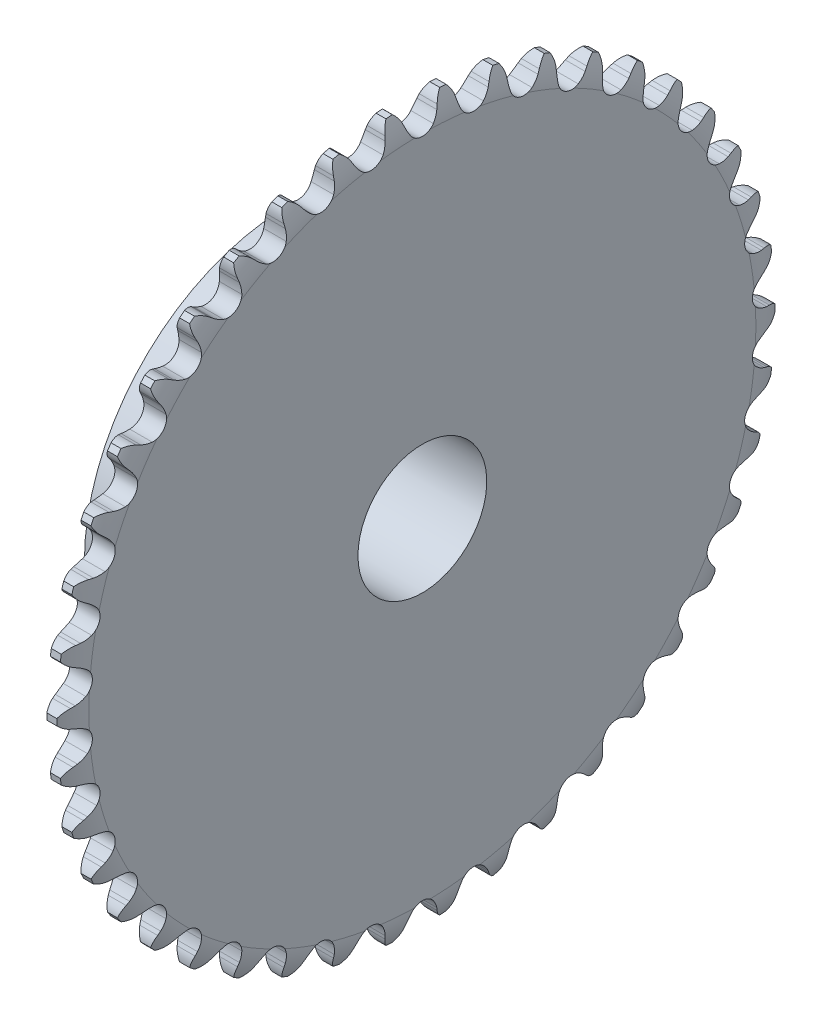
from build123d import *

# Parameters (mm, degrees)
TOOTHCUT_DEPTH   = 63.673265406
TEETHCUTS_COUNT  = 42
TEETHCUTS_ANGLE  = 351.428571429
HUBNEAONESKE_R   = 25.4
HUBNEARONE_DEPTH = 13.4560056
BORSKE_R         = 7.9375
BORE_DEPTH       = 16.2563556


with BuildPart() as part:
    # BasProSke → Base-Revolve (revolve)
    with BuildSketch(Plane(origin=(0, 0, 0), x_dir=(1, 0, 0), z_dir=(0, 1, 0))):
        with BuildLine():
            Line((0, 0), (0, 41.097430679))
            ThreePointArc((0, 41.097430679), (0.199787117, 42.733021074), (0.7874, 44.272430679))
            Line((0.7874, 44.272430679), (2.01295, 44.272430679))
            ThreePointArc((2.01295, 44.272430679), (2.600562883, 42.733021074), (2.80035, 41.097430679))
            Line((2.80035, 41.097430679), (2.80035, 0))
            Line((2.80035, 0), (0, 0))
        make_face()
    revolve(axis=Axis((-10, 0, 0), (1, 0, 0)))

    # TooCutSke → ToothCut (cut, through all)
    with BuildSketch(Plane(origin=(0, 0, 0), x_dir=(0, 0, -1), z_dir=(1, 0, 0))):
        with BuildLine():
            Line((1.95799015, 42.587812294), (2.118904161, 43.035702304))
            ThreePointArc((2.118904161, 43.035702304), (3.087198965, 44.305785242), (4.609873714, 44.787622463))
            ThreePointArc((4.609873714, 44.787622463), (0, 45.0242386), (-4.609873714, 44.787622463))
            ThreePointArc((-4.609873714, 44.787622463), (-3.087198965, 44.305785242), (-2.118904161, 43.035702304))
            Line((-2.118904161, 43.035702304), (-1.95799015, 42.587812294))
            ThreePointArc((-1.95799015, 42.587812294), (-1.702253121, 42.011484957), (-1.365688064, 41.478307136))
            ThreePointArc((-1.365688064, 41.478307136), (0, 40.788875797), (1.365688064, 41.478307136))
            ThreePointArc((1.365688064, 41.478307136), (1.702253121, 42.011484957), (1.95799015, 42.587812294))
        make_face()
    toothcut = extrude(amount=TOOTHCUT_DEPTH, mode=Mode.SUBTRACT)

    # TeethCuts: ToothCut ×42 about axis
    teethcuts_axis = Axis((-10, 0, 0), (1, 0, 0))
    for i in range(1, TEETHCUTS_COUNT):
        add(toothcut.rotate(teethcuts_axis, i * TEETHCUTS_ANGLE / (TEETHCUTS_COUNT - 1)), mode=Mode.SUBTRACT)

    # HubNeaOneSke → HubNearOne (add)
    with BuildSketch(Plane.ZY):
        Circle(HUBNEAONESKE_R)
    extrude(amount=HUBNEARONE_DEPTH)

    # BorSke → Bore (cut, symmetric)
    with BuildSketch(Plane(origin=(0, 0, 0), x_dir=(0, 0, -1), z_dir=(1, 0, 0))):
        Circle(BORSKE_R)
    extrude(amount=BORE_DEPTH, both=True, mode=Mode.SUBTRACT)


solid = part.part
